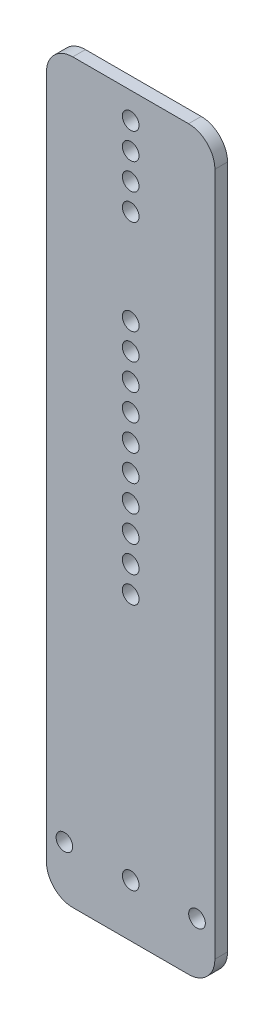
from build123d import *

# Parameters (mm, degrees)
SKETCH1_W           = 40.64
SKETCH1_H           = 177.8
BOSS_EXTRUDE1_DEPTH = 3.048
SKETCH2_R           = 2.0066
CUT_EXTRUDE1_DEPTH  = 3.048
SKETCH3_R           = 2.0193
CUT_EXTRUDE2_DEPTH  = 92.243644732
FILLET1_R           = 6.35


with BuildPart() as part:
    # Sketch1 → Boss-Extrude1 (new body)
    with BuildSketch(Plane.XY):
        Rectangle(SKETCH1_W, SKETCH1_H)
    extrude(amount=BOSS_EXTRUDE1_DEPTH)

    # Sketch2 → Cut-Extrude1 (cut)
    with BuildSketch(Plane.XY.offset(3.048)):
        with Locations((0, -76.2)):
            Circle(SKETCH2_R)
        with Locations((0, 82.55)):
            Circle(SKETCH2_R)
        with Locations((0, 76.2)):
            Circle(SKETCH2_R)
        with Locations((0, 69.85)):
            Circle(SKETCH2_R)
        with Locations((0, 63.5)):
            Circle(SKETCH2_R)
        with Locations((16.002, -76.2)):
            Circle(SKETCH2_R)
        with Locations((-16.002, -76.2)):
            Circle(SKETCH2_R)
    extrude(amount=-CUT_EXTRUDE1_DEPTH, mode=Mode.SUBTRACT)

    # Sketch3 → Cut-Extrude2 (cut, through all)
    with BuildSketch(Plane.XY.offset(3.048)):
        with Locations((0, -16.4846)):
            Circle(SKETCH3_R)
        with Locations((0, -10.1346)):
            Circle(SKETCH3_R)
        with Locations((0, -3.7846)):
            Circle(SKETCH3_R)
        with Locations((0, 2.5654)):
            Circle(SKETCH3_R)
        with Locations((0, 8.9154)):
            Circle(SKETCH3_R)
        with Locations((0, 15.2654)):
            Circle(SKETCH3_R)
        with Locations((0, 21.6154)):
            Circle(SKETCH3_R)
        with Locations((0, 27.9654)):
            Circle(SKETCH3_R)
        with Locations((0, 34.3154)):
            Circle(SKETCH3_R)
        with Locations((0, 40.6654)):
            Circle(SKETCH3_R)
    extrude(amount=-CUT_EXTRUDE2_DEPTH, mode=Mode.SUBTRACT)

    # Fillet1
    fillet1_edges = [part.edges().sort_by_distance(p)[0] for p in [
        (20.32, -88.9, 1.524),
        (-20.32, -88.9, 1.524),
        (20.32, 88.9, 1.524),
        (-20.32, 88.9, 1.524),
    ]]
    fillet(fillet1_edges, radius=FILLET1_R)


solid = part.part
